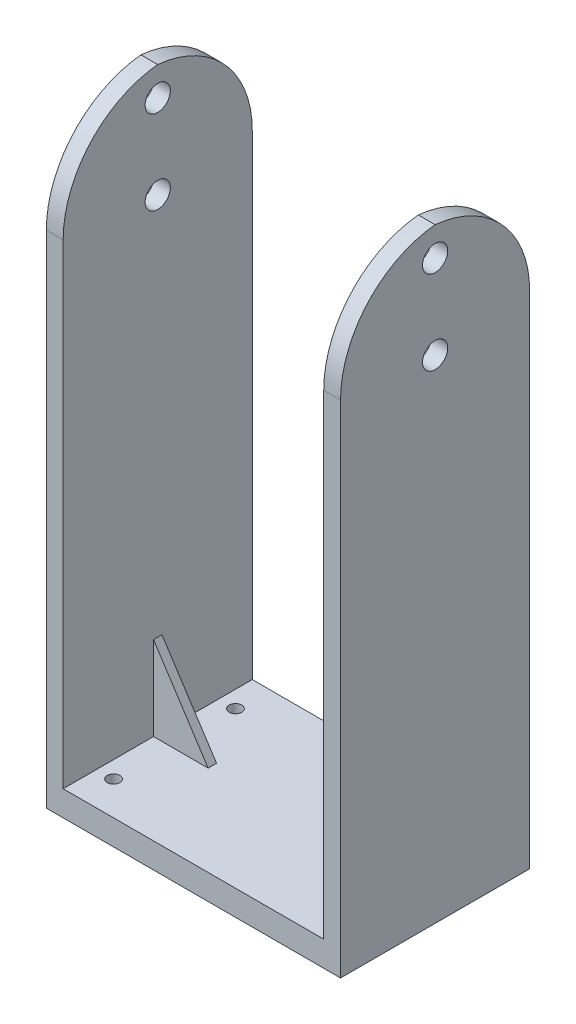
from build123d import *

# Parameters (mm, degrees)
SKETCH1_W                = 70
SKETCH1_H                = 45
BOSS_EXTRUDE1_DEPTH      = 6
CUT_EXTRUDE1_REACH       = 410.214
SKETCH4_R                = 1.5
SKETCH5_W                = 4
SKETCH5_H                = 45
BOSS_EXTRUDE2_DEPTH      = 138.11
CUT_EXTRUDE2_REACH       = 393.806
SKETCH6_R                = 3
FILLET1_R                = 25
BOSS_EXTRUDE3_DEPTH      = 1
BOSS_EXTRUDE3_DEPTH_BACK = 1


with BuildPart() as part:
    # Sketch1 → Boss-Extrude1 (new body)
    with BuildSketch(Plane(origin=(148.74203414, 0, 254.057769676), x_dir=(1, 0, 0), z_dir=(0, -1, 0))):
        with Locations((13.131189711, 80.994934751)):
            Rectangle(SKETCH1_W, SKETCH1_H)
    extrude(amount=-BOSS_EXTRUDE1_DEPTH)

    # Sketch4 → Cut-Extrude1 (cut, up to next)
    with BuildSketch(Plane(origin=(0, 6, 0), x_dir=(-1, 0, 0), z_dir=(0, 1, 0)), mode=Mode.PRIVATE) as cut_extrude1_sk1:
        with Locations(Location((-188.87322385, 320.552704426, 0), (0, 0, 90))):
            Circle(SKETCH4_R)
    cut_extrude1_tool1 = extrude(cut_extrude1_sk1.sketch, amount=-CUT_EXTRUDE1_REACH, mode=Mode.PRIVATE) & part.part
    # Sketch4 → Cut-Extrude1 (cut, up to next)
    with BuildSketch(Plane(origin=(0, 6, 0), x_dir=(-1, 0, 0), z_dir=(0, 1, 0)), mode=Mode.PRIVATE) as cut_extrude1_sk2:
        with Locations(Location((-188.87322385, 349.552704426, 0), (0, 0, 90))):
            Circle(SKETCH4_R)
    cut_extrude1_tool2 = extrude(cut_extrude1_sk2.sketch, amount=-CUT_EXTRUDE1_REACH, mode=Mode.PRIVATE) & part.part
    # Sketch4 → Cut-Extrude1 (cut, up to next)
    with BuildSketch(Plane(origin=(0, 6, 0), x_dir=(-1, 0, 0), z_dir=(0, 1, 0)), mode=Mode.PRIVATE) as cut_extrude1_sk3:
        with Locations(Location((-134.87322385, 320.552704426, 0), (0, 0, 90))):
            Circle(SKETCH4_R)
    cut_extrude1_tool3 = extrude(cut_extrude1_sk3.sketch, amount=-CUT_EXTRUDE1_REACH, mode=Mode.PRIVATE) & part.part
    # Sketch4 → Cut-Extrude1 (cut, up to next)
    with BuildSketch(Plane(origin=(0, 6, 0), x_dir=(-1, 0, 0), z_dir=(0, 1, 0)), mode=Mode.PRIVATE) as cut_extrude1_sk4:
        with Locations(Location((-134.87322385, 349.552704426, 0), (0, 0, 90))):
            Circle(SKETCH4_R)
    cut_extrude1_tool4 = extrude(cut_extrude1_sk4.sketch, amount=-CUT_EXTRUDE1_REACH, mode=Mode.PRIVATE) & part.part
    add(cut_extrude1_tool1.solids().sort_by_distance((188.873224, 6, 320.552704))[0], mode=Mode.SUBTRACT)
    add(cut_extrude1_tool2.solids().sort_by_distance((188.873224, 6, 349.552704))[0], mode=Mode.SUBTRACT)
    add(cut_extrude1_tool3.solids().sort_by_distance((134.873224, 6, 320.552704))[0], mode=Mode.SUBTRACT)
    add(cut_extrude1_tool4.solids().sort_by_distance((134.873224, 6, 349.552704))[0], mode=Mode.SUBTRACT)

    # Sketch5 → Boss-Extrude2 (add)
    with BuildSketch(Plane(origin=(0, 6, 0), x_dir=(-1, 0, 0), z_dir=(0, -1, 0))):
        with Locations((-128.87322385, -335.052704426)):
            Rectangle(SKETCH5_W, SKETCH5_H)
    boss_extrude2 = extrude(amount=-BOSS_EXTRUDE2_DEPTH)

    # Sketch6 → Cut-Extrude2 (cut, up to next)
    with BuildSketch(Plane.ZY.offset(-126.87322385), mode=Mode.PRIVATE) as cut_extrude2_sk1:
        with Locations((335.052704426, 137.11)):
            Circle(SKETCH6_R)
    cut_extrude2_tool1 = extrude(cut_extrude2_sk1.sketch, amount=-CUT_EXTRUDE2_REACH, mode=Mode.PRIVATE) & part.part
    # Sketch6 → Cut-Extrude2 (cut, up to next)
    with BuildSketch(Plane.ZY.offset(-126.87322385), mode=Mode.PRIVATE) as cut_extrude2_sk2:
        with Locations((335.052704426, 117.11)):
            Circle(SKETCH6_R)
    cut_extrude2_tool2 = extrude(cut_extrude2_sk2.sketch, amount=-CUT_EXTRUDE2_REACH, mode=Mode.PRIVATE) & part.part
    cut_extrude2_1 = cut_extrude2_tool1.solids().sort_by_distance((126.873224, 137.11, 335.052704))[0]
    add(cut_extrude2_1, mode=Mode.SUBTRACT)
    cut_extrude2_2 = cut_extrude2_tool2.solids().sort_by_distance((126.873224, 117.11, 335.052704))[0]
    add(cut_extrude2_2, mode=Mode.SUBTRACT)
    cut_extrude2 = cut_extrude2_1 + cut_extrude2_2  # Cut-Extrude2 as one shape, for the pattern or mirror that repeats it

    # Mirror1: Boss-Extrude2, Cut-Extrude2 across plane
    add(boss_extrude2.mirror(Plane(origin=(161.87322385, 0, 0), x_dir=(0, 0, 1), z_dir=(1, 0, 0))))
    add(cut_extrude2.mirror(Plane(origin=(161.87322385, 0, 0), x_dir=(0, 0, 1), z_dir=(1, 0, 0))), mode=Mode.SUBTRACT)

    # Fillet1
    # the kernel refuses this fillet: 25 mm, written as the material it takes off along each edge
    with BuildSketch(Plane(origin=(259.37322385, 144.11, 312.552704426), x_dir=(0, 0, 1), z_dir=(-1, 0, 0)), Plane(origin=(193.37322385, 144.11, 357.552704426), x_dir=(0, -1, 0), z_dir=(-1, 0, 0))) as fillet1_piece_1:
        with BuildLine():
            CenterArc((FILLET1_R, -FILLET1_R), FILLET1_R, 90, 90)
            Line((0, -FILLET1_R), (0, 0))
            Line((0, 0), (FILLET1_R, 0))
        make_face()
    extrude(amount=129, mode=Mode.SUBTRACT)
    with BuildSketch(Plane(origin=(130.37322385, 144.11, 357.552704426), x_dir=(0, -1, 0), z_dir=(1, 0, 0)), Plane(origin=(64.37322385, 144.11, 312.552704426), x_dir=(0, 0, 1), z_dir=(1, 0, 0))) as fillet1_piece_2:
        with BuildLine():
            CenterArc((FILLET1_R, FILLET1_R), FILLET1_R, 180, 90)
            Line((0, FILLET1_R), (0, 0))
            Line((0, 0), (FILLET1_R, 0))
        make_face()
    extrude(amount=129, mode=Mode.SUBTRACT)

    # Sketch8 → Boss-Extrude3 (add, two sides: drawn at the far end of the back side and taken through both)
    with BuildSketch(Plane(origin=(0, 0, 335.052704426), x_dir=(-1, 0, 0), z_dir=(0, 0, -1)).offset(-BOSS_EXTRUDE3_DEPTH_BACK)):
        Polygon((-192.87322385, 6), (-192.87322385, 26), (-179.87322385, 6), align=None)
        Polygon((-130.87322385, 26), (-143.87322385, 6), (-130.87322385, 6), align=None)
    extrude(amount=BOSS_EXTRUDE3_DEPTH + BOSS_EXTRUDE3_DEPTH_BACK)


solid = part.part
